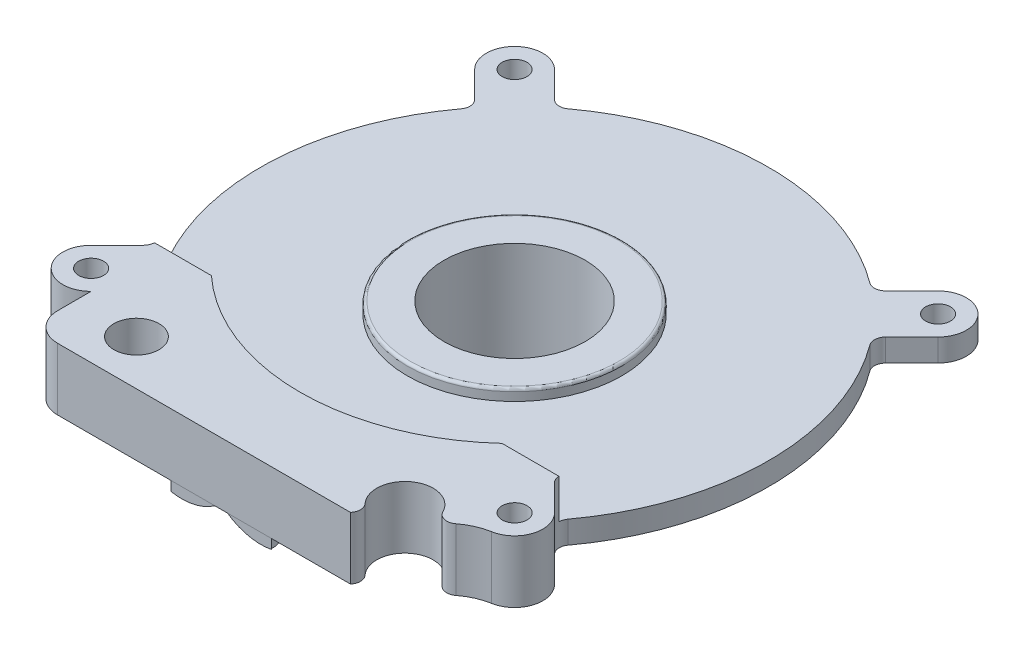
from build123d import *
from build123d.topology import SkipClean

# Parameters (mm, degrees)
SKETCH_1_R          = 15
SKETCH_1_R_2        = 12.5
EXTRUDE_1_DEPTH     = 20
SKETCH_2_R          = 17
SKETCH_2_R_2        = 12.5
EXTRUDE_2_DEPTH     = 6
SKETCH_3_R          = 12.5
SKETCH_3_R_2        = 7
SKETCH_3_R_3        = 1.65
EXTRUDE_3_DEPTH     = 3
EXTRUDE_START       = -2
SKETCH_5_R          = 19
SKETCH_5_R_2        = 17
EXTRUDE_5_DEPTH     = 2
SKETCH_6_W          = 26
SKETCH_6_H          = 26
SKETCH_6_R          = 12.5
EXTRUDE_6_DEPTH     = 2
EXTRUDE_START_2     = 4
SKETCH_7_R          = 45
SKETCH_7_R_2        = 17
EXTRUDE_7_DEPTH     = 4
EXTRUDE_START_3     = -4
SKETCH_8_R          = 2.2
EXTRUDE_8_DEPTH     = 4
SKETCH_9_R          = 4
EXTRUDE_9_DEPTH     = 4
FILLET_1_R          = 2
SKETCH_10_R         = 19
CUT_EXTRUDE_1_DEPTH = 74.492092218
FILLET_2_R          = 0.5
FILLET_3_R          = 5
SKETCH_11_R         = 3
CUT_EXTRUDE_2_DEPTH = 1.5
EXTRUDE_START_4     = 1
SKETCH_12_R         = 15.75
SKETCH_12_R_2       = 15
EXTRUDE_10_DEPTH    = 1
SKETCH_13_R         = 4
SKETCH_13_R_2       = 2.2
EXTRUDE_11_DEPTH    = 4.2
EXTRUDE_12_DEPTH    = 7
EXTRUDE_12_2_DEPTH  = 7
CHAMFER_1_SIZE      = 6.214619975
CHAMFER_1_SIZE_2    = 1.9
CHAMFER_2_SIZE      = 6.214619975
CHAMFER_2_SIZE_2    = 1.9
CUT_EXTRUDE_4_DEPTH = 10
FILLET_4_R          = 2
SKETCH_16_R         = 2.2
SKETCH_16_R_2       = 4
EXTRUDE_13_DEPTH    = 3
CUT_EXTRUDE_START   = -0.2
CUT_EXTRUDE_5_DEPTH = 0.2


with BuildPart() as part:
    # 草图1 → 凸台-拉伸1 (new body)
    with BuildSketch(Plane(origin=(0, 0, 0), x_dir=(1, 0, 0), z_dir=(0, 1, 0))):
        with Locations(Location((0, 0, 0), (0, 0, 270))):
            Circle(SKETCH_1_R)
        with Locations(Location((0, 0, 0), (0, 0, 270))):
            Circle(SKETCH_1_R_2, mode=Mode.SUBTRACT)
    extrude(amount=EXTRUDE_1_DEPTH)

    # 草图2 → 凸台-拉伸2 (add)
    with BuildSketch(Plane(origin=(0, 20, 0), x_dir=(1, 0, 0), z_dir=(0, 1, 0))):
        with Locations(Location((0, 0, 0), (0, 0, 270))):
            Circle(SKETCH_2_R)
        with Locations(Location((0, 0, 0), (0, 0, 270))):
            Circle(SKETCH_2_R_2, mode=Mode.SUBTRACT)
    extrude(amount=EXTRUDE_2_DEPTH)

    # 草图3 → 凸台-拉伸3 (add)
    with BuildSketch(Plane.XZ):
        with Locations(Location((0, 0, 0), (0, 0, 270))):
            Circle(SKETCH_3_R)
        with Locations(Location((0, 0, 0), (0, 0, 270))):
            Circle(SKETCH_3_R_2, mode=Mode.SUBTRACT)
        with Locations(Location((9.5, 0, 0), (0, 0, 270))):
            Circle(SKETCH_3_R_3, mode=Mode.SUBTRACT)
        with Locations(Location((-4.75, -8.227241336, 0), (0, 0, 270))):
            Circle(SKETCH_3_R_3, mode=Mode.SUBTRACT)
        with Locations(Location((-4.75, 8.227241336, 0), (0, 0, 270))):
            Circle(SKETCH_3_R_3, mode=Mode.SUBTRACT)
    extrude(amount=-EXTRUDE_3_DEPTH)

    # 草图5 → 凸台-拉伸5 (add)
    with BuildSketch(Plane(origin=(0, 26, 0), x_dir=(1, 0, 0), z_dir=(0, 1, 0)).offset(EXTRUDE_START)):
        with Locations(Location((0, 0, 0), (0, 0, 270))):
            Circle(SKETCH_5_R)
        with Locations(Location((0, 0, 0), (0, 0, 270))):
            Circle(SKETCH_5_R_2, mode=Mode.SUBTRACT)
    extrude(amount=EXTRUDE_5_DEPTH)

    # 草图6 → 凸台-拉伸6 (add)
    with BuildSketch(Plane(origin=(0, 26, 0), x_dir=(1, 0, 0), z_dir=(0, 1, 0))):
        Rectangle(SKETCH_6_W, SKETCH_6_H)
        with Locations(Location((0, 0, 0), (0, 0, 90))):
            Circle(SKETCH_6_R, mode=Mode.SUBTRACT)
    extrude(amount=EXTRUDE_6_DEPTH)

    # 草图7 → 凸台-拉伸7 (add)
    with BuildSketch(Plane.XZ.offset(-24).offset(EXTRUDE_START_2)):
        with Locations(Location((0, 0, 0), (0, 0, 270))):
            Circle(SKETCH_7_R)
        Circle(SKETCH_7_R_2, mode=Mode.SUBTRACT)
    extrude(amount=-EXTRUDE_7_DEPTH)

    # 草图8 → 凸台-拉伸8 (add)
    # profile 1 of 4: a face of its own
    with BuildSketch(Plane(origin=(0, 24, 0), x_dir=(1, 0, 0), z_dir=(0, 1, 0)).offset(EXTRUDE_START_3)):
        with BuildLine():
            Line((-41.035533906, -33.964466094), (-35.158310508, -28.087242696))
            ThreePointArc((-35.158310508, -28.087242696), (-31.819805153, -31.819805153), (-28.087242696, -35.158310508))
            Line((-28.087242696, -35.158310508), (-33.964466094, -41.035533906))
            ThreePointArc((-33.964466094, -41.035533906), (-41.035533906, -41.035533906), (-41.035533906, -33.964466094))
        make_face()
        with Locations(Location((-37.5, -37.5, 0), (0, 0, 270))):
            Circle(SKETCH_8_R, mode=Mode.SUBTRACT)
    # profile 2 of 4: a face of its own
    with BuildSketch(Plane(origin=(0, 24, 0), x_dir=(1, 0, 0), z_dir=(0, 1, 0)).offset(EXTRUDE_START_3)):
        with BuildLine():
            Line((-41.035533906, 33.964466094), (-35.158310508, 28.087242696))
            ThreePointArc((-35.158310508, 28.087242696), (-31.819805153, 31.819805153), (-28.087242696, 35.158310508))
            Line((-28.087242696, 35.158310508), (-33.964466094, 41.035533906))
            ThreePointArc((-33.964466094, 41.035533906), (-41.035533906, 41.035533906), (-41.035533906, 33.964466094))
        make_face()
        with Locations(Location((-37.5, 37.5, 0), (0, 0, 270))):
            Circle(SKETCH_8_R, mode=Mode.SUBTRACT)
    # profile 3 of 4: a face of its own
    with BuildSketch(Plane(origin=(0, 24, 0), x_dir=(1, 0, 0), z_dir=(0, 1, 0)).offset(EXTRUDE_START_3)):
        with BuildLine():
            Line((28.087242696, 35.158310508), (33.964466094, 41.035533906))
            ThreePointArc((33.964466094, 41.035533906), (41.035533906, 41.035533906), (41.035533906, 33.964466094))
            Line((41.035533906, 33.964466094), (35.158310508, 28.087242696))
            ThreePointArc((35.158310508, 28.087242696), (31.819805153, 31.819805153), (28.087242696, 35.158310508))
        make_face()
        with Locations(Location((37.5, 37.5, 0), (0, 0, 270))):
            Circle(SKETCH_8_R, mode=Mode.SUBTRACT)
    # profile 4 of 4: a face of its own
    with BuildSketch(Plane(origin=(0, 24, 0), x_dir=(1, 0, 0), z_dir=(0, 1, 0)).offset(EXTRUDE_START_3)):
        with BuildLine():
            Line((35.158310508, -28.087242696), (41.035533906, -33.964466094))
            ThreePointArc((41.035533906, -33.964466094), (41.035533906, -41.035533906), (33.964466094, -41.035533906))
            Line((33.964466094, -41.035533906), (28.087242696, -35.158310508))
            ThreePointArc((28.087242696, -35.158310508), (31.819805153, -31.819805153), (35.158310508, -28.087242696))
        make_face()
        with Locations(Location((37.5, -37.5, 0), (0, 0, 270))):
            Circle(SKETCH_8_R, mode=Mode.SUBTRACT)
    extrude(amount=EXTRUDE_8_DEPTH)

    # 草图9 → 凸台-拉伸9 (add)
    with BuildSketch(Plane(origin=(0, 24, 0), x_dir=(1, 0, 0), z_dir=(0, 1, 0)).offset(EXTRUDE_START_3)):
        with BuildLine():
            Line((33.964466094, -41.035533906), (28.087242696, -35.158310508))
            ThreePointArc((28.087242696, -35.158310508), (0, -45), (-28.087242696, -35.158310508))
            Line((-28.087242696, -35.158310508), (-33.964466094, -41.035533906))
            Line((-33.964466094, -41.035533906), (-33.964466094, -51.96236733))
            Line((-33.964466094, -51.96236733), (22.906384924, -51.96236733))
            Line((22.906384924, -51.96236733), (27.649740331, -50.798447588))
            ThreePointArc((27.649740331, -50.798447588), (23.364635585, -42.046040599), (31.045885235, -48.043136112))
            ThreePointArc((31.045885235, -48.043136112), (34.020425636, -44.337927578), (38.36930714, -42.423850637))
            ThreePointArc((38.36930714, -42.423850637), (35.996987316, -42.268747516), (33.964466094, -41.035533906))
        make_face()
        with Locations(Location((-23.001616716, -43.96067534, 0), (0, 0, 270))):
            Circle(SKETCH_9_R, mode=Mode.SUBTRACT)
    extrude(amount=EXTRUDE_9_DEPTH)

    # 圆角1
    # the kernel refuses this fillet: 2 mm, written as the material it takes off along each edge
    with BuildSketch(Plane(origin=(31.045885235, 8.214854918, 48.043136112), x_dir=(-0.015052067443698006, 0, -0.9998867112156609), z_dir=(0, 1, 0))) as fillet_1_piece_1:
        with BuildLine():
            CenterArc((5.237242596, -1.799472632), FILLET_1_R, 115.876571243, 100.980737452)
            Line((3.636978972, -2.999121053), (3.6049737, -3.023114021))
            ThreePointArc((3.6049737, -3.023114021), (1.972291731, -1.313047371), (-0.017457357, -0.035989453))
            Line((-0.017457357, -0.035989453), (0.017457357, 0.035989453))
            ThreePointArc((0.017457357, 0.035989453), (2.182187383, -0.461322512), (4.34691741, 0.035989453))
            Line((4.34691741, 0.035989453), (4.364374767, 0))
        make_face()
    extrude(amount=27.570290164, mode=Mode.SUBTRACT)
    with BuildSketch(Plane(origin=(27.649740331, 7.426134815, 50.798447588), x_dir=(-0.9711892764491741, 0, 0.23830944024551268), z_dir=(0, 1, 0))) as fillet_1_piece_2:
        with BuildLine():
            CenterArc((6.067575487, -1.612238295), FILLET_1_R, 126.281523765, 82.66024712)
            Line((4.317351562, -2.580079301), (4.282347084, -2.599436121))
            ThreePointArc((4.282347084, -2.599436121), (2.486180213, -0.742013172), (-0.000465948, -0.039997286))
            Line((-0.000465948, -0.039997286), (0, 0.04))
            ThreePointArc((0, 0.04), (2.442034484, 0.04), (4.860398838, 0.032244766))
            Line((4.860398838, 0.032244766), (4.884068968, 0))
        make_face()
    extrude(amount=29.147730371, mode=Mode.SUBTRACT)

    # 草图10 → 切除-拉伸1 (cut, through all)
    with BuildSketch(Plane(origin=(0, 26, 0), x_dir=(1, 0, 0), z_dir=(0, 1, 0))):
        with Locations(Location((0, 0, 0), (0, 0, 270))):
            Circle(SKETCH_10_R)
    extrude(amount=CUT_EXTRUDE_1_DEPTH, mode=Mode.SUBTRACT)

    # 圆角2
    fillet_2_edges = [part.edges().sort_by_distance(p)[0] for p in [
        (0, 26, -19),
    ]]
    fillet(fillet_2_edges, radius=FILLET_2_R)

    # 圆角3
    fillet_3_edges = [part.edges().sort_by_distance(p)[0] for p in [
        (-33.964466094, 22, 51.96236733),
    ]]
    fillet(fillet_3_edges, radius=FILLET_3_R)

    # 草图11 → 切除-拉伸2 (cut)
    with BuildSketch(Plane.XZ):
        with Locations((-4.75, 8.227241336)):
            Circle(SKETCH_11_R)
        with Locations((9.5, 0)):
            Circle(SKETCH_11_R)
        with Locations((-4.75, -8.227241336)):
            Circle(SKETCH_11_R)
    extrude(amount=-CUT_EXTRUDE_2_DEPTH, mode=Mode.SUBTRACT)

    # 草图12 → 凸台-拉伸10 (add)
    with BuildSketch(Plane.XZ.offset(-20).offset(EXTRUDE_START_4)):
        with Locations(Location((0, 0, 0), (0, 0, 90))):
            Circle(SKETCH_12_R)
        with Locations(Location((0, 0, 0), (0, 0, 270))):
            Circle(SKETCH_12_R_2, mode=Mode.SUBTRACT)
    extrude(amount=-EXTRUDE_10_DEPTH)

    # 草图13 → 凸台-拉伸11 (add)
    # profile 1 of 2: a face of its own
    with BuildSketch(Plane(origin=(0, 24, 0), x_dir=(1, 0, 0), z_dir=(0, 1, 0))):
        with BuildLine():
            Line((-25.73142074, -27.96236733), (-35.257708566, -27.96236733))
            ThreePointArc((-35.257708566, -27.96236733), (-35.2080649, -28.024849081), (-35.158310508, -28.087242696))
            ThreePointArc((-35.158310508, -28.087242696), (0, -45), (35.158310508, -28.087242696))
            ThreePointArc((35.158310508, -28.087242696), (35.2080649, -28.024849081), (35.257708566, -27.96236733))
            Line((35.257708566, -27.96236733), (25.73142074, -27.96236733))
            ThreePointArc((25.73142074, -27.96236733), (0, -38), (-25.73142074, -27.96236733))
        make_face()
    # profile 2 of 2: a face of its own
    with BuildSketch(Plane(origin=(0, 24, 0), x_dir=(1, 0, 0), z_dir=(0, 1, 0))):
        with BuildLine():
            ThreePointArc((35.158310508, -28.087242696), (0, -45), (-35.158310508, -28.087242696))
            Line((-35.158310508, -28.087242696), (-41.035533906, -33.964466094))
            ThreePointArc((-41.035533906, -33.964466094), (-41.035533906, -41.035533906), (-33.964466094, -41.035533906))
            Line((-33.964466094, -41.035533906), (-33.964466094, -46.96236733))
            ThreePointArc((-33.964466094, -46.96236733), (-32.5, -50.497901236), (-28.964466094, -51.96236733))
            Line((-28.964466094, -51.96236733), (22.906384924, -51.96236733))
            ThreePointArc((22.906384924, -51.96236733), (23.372168796, -50.629809961), (22.841917537, -49.321567873))
            ThreePointArc((22.841917537, -49.321567873), (23.665985567, -41.819836541), (30.980192372, -43.67925578))
            ThreePointArc((30.980192372, -43.67925578), (32.324226236, -44.729926812), (33.989922469, -44.361426197))
            ThreePointArc((33.989922469, -44.361426197), (36.06191813, -43.126615751), (38.36930714, -42.423850637))
            ThreePointArc((38.36930714, -42.423850637), (42.268747516, -39.003012684), (41.035533906, -33.964466094))
            Line((41.035533906, -33.964466094), (35.158310508, -28.087242696))
        make_face()
        with Locations(Location((-23.001616716, -43.96067534, 0), (0, 0, 270))):
            Circle(SKETCH_13_R, mode=Mode.SUBTRACT)
        with Locations(Location((-37.5, -37.5, 0), (0, 0, 270))):
            Circle(SKETCH_13_R_2, mode=Mode.SUBTRACT)
        with Locations(Location((37.5, -37.5, 0), (0, 0, 270))):
            Circle(SKETCH_13_R_2, mode=Mode.SUBTRACT)
    extrude(amount=EXTRUDE_11_DEPTH)

    # 圆角4
    # the kernel refuses this fillet: 2 mm, written as the material it adds along each edge
    with BuildSketch(Plane(origin=(-35.158310508, 24, 28.087242696), x_dir=(-0.6091445543009105, 0, -0.793059210882482), z_dir=(0, 1, 0))) as fillet_4_piece_1_section:
        with BuildLine():
            CenterArc((1.754855317, 1.99963613), FILLET_4_R, 187.472325658, 81.434718893)
            Line((-0.228160265, 1.739541528), (0, 0))
            ThreePointArc((0, 0), (0.858353144, 0.008187079), (1.716706288, 0))
        make_face()
    fillet_4_piece_1 = extrude(amount=4.2, mode=Mode.PRIVATE)
    fillet_4_piece_1 = split(fillet_4_piece_1, bisect_by=Plane(origin=(-35.158310508, 24, 27.96236733), z_dir=(0, 0, 1)), keep=Keep.TOP, mode=Mode.PRIVATE)
    add(fillet_4_piece_1)
    with BuildSketch(Plane(origin=(28.087242696, 20, -35.158310508), x_dir=(0.7071067811865485, 0, -0.7071067811865465), z_dir=(0, 1, 0)), Plane(origin=(-35.158310508, 20, -28.087242696), x_dir=(-0.7071067811865496, 0, -0.7071067811865455), z_dir=(0, 1, 0))) as fillet_4_piece_2:
        with BuildLine():
            CenterArc((1.754440604, 2), FILLET_4_R, 188.565281108, 81.434718892)
            ThreePointArc((-0.223253019, 1.70212766), (-0.103508957, 0.852128537), (0, 0))
            Line((0, 0), (1.754440604, 0))
        make_face()
    extrude(amount=4)
    with BuildSketch(Plane(origin=(35.158310508, 20, -28.087242696), x_dir=(0.6091445542993271, 0, 0.7930592108836982), z_dir=(0, 1, 0)), Plane(origin=(-28.087242696, 20, -35.158310508), x_dir=(0.7930592108837022, 0, -0.6091445542993219), z_dir=(0, 1, 0)), Plane(origin=(-35.158310508, 20, 28.087242696), x_dir=(-0.6091445542993226, 0, -0.7930592108837018), z_dir=(0, 1, 0))) as fillet_4_piece_3:
        with BuildLine():
            CenterArc((1.754855317, 1.99963613), FILLET_4_R, 187.472325658, 81.434718892)
            Line((-0.228160265, 1.739541528), (0, 0))
            ThreePointArc((0, 0), (0.858353144, 0.008187079), (1.716706288, 0))
        make_face()
    extrude(amount=4)
    with BuildSketch(Plane(origin=(35.158310508, 24, 28.087242696), x_dir=(0.6091445574940213, 0, -0.7930592084298707), z_dir=(0, 1, 0))) as fillet_4_piece_4_section:
        with BuildLine():
            CenterArc((1.754855324, -1.99963613), FILLET_4_R, 91.092955673, 81.4347189)
            Line((-0.228160259, -1.739541536), (0, 0))
            ThreePointArc((0, 0), (0.858353144, -0.008187083), (1.716706288, 0))
        make_face()
    fillet_4_piece_4 = extrude(amount=4.2, mode=Mode.PRIVATE)
    fillet_4_piece_4 = split(fillet_4_piece_4, bisect_by=Plane(origin=(35.158310508, 24, 27.96236733), z_dir=(0, 0, 1)), keep=Keep.TOP, mode=Mode.PRIVATE)
    add(fillet_4_piece_4)
    with BuildSketch(Plane(origin=(35.158310508, 20, 28.087242696), x_dir=(0.609144554299323, 0, -0.7930592108837013), z_dir=(0, 1, 0))) as fillet_4_piece_5:
        with BuildLine():
            CenterArc((1.754855317, -1.99963613), FILLET_4_R, 91.09295545, 81.434718892)
            Line((-0.228160265, -1.739541528), (0, 0))
            ThreePointArc((0, 0), (0.858353144, -0.008187079), (1.716706288, 0))
        make_face()
    extrude(amount=4)

    # 草图16 → 凸台-拉伸13 (add)
    with BuildSketch(Plane(origin=(0, 28.2, 0), x_dir=(1, 0, 0), z_dir=(0, 1, 0))):
        with BuildLine():
            Line((-25.73142074, -27.96236733), (-35.813695424, -27.96236733))
            ThreePointArc((-35.813695424, -27.96236733), (-35.974809945, -28.701442447), (-36.398887356, -29.327819544))
            Line((-36.398887356, -29.327819544), (-41.035533906, -33.964466094))
            ThreePointArc((-41.035533906, -33.964466094), (-41.035533906, -41.035533906), (-33.964466094, -41.035533906))
            Line((-33.964466094, -41.035533906), (-33.964466094, -46.96236733))
            ThreePointArc((-33.964466094, -46.96236733), (-32.5, -50.497901236), (-28.964466094, -51.96236733))
            Line((-28.964466094, -51.96236733), (22.906384924, -51.96236733))
            ThreePointArc((22.906384924, -51.96236733), (23.372168796, -50.629809961), (22.841917537, -49.321567873))
            ThreePointArc((22.841917537, -49.321567873), (23.665985567, -41.819836541), (30.980192372, -43.67925578))
            ThreePointArc((30.980192372, -43.67925578), (32.324226236, -44.729926812), (33.989922469, -44.361426197))
            ThreePointArc((33.989922469, -44.361426197), (36.06191813, -43.126615751), (38.36930714, -42.423850637))
            ThreePointArc((38.36930714, -42.423850637), (42.268747516, -39.003012684), (41.035533906, -33.964466094))
            Line((41.035533906, -33.964466094), (36.398887356, -29.327819544))
            ThreePointArc((36.398887356, -29.327819544), (35.974809945, -28.701442447), (35.813695424, -27.96236733))
            Line((35.813695424, -27.96236733), (25.73142074, -27.96236733))
            ThreePointArc((25.73142074, -27.96236733), (0, -38), (-25.73142074, -27.96236733))
        make_face()
        with Locations(Location((-37.5, -37.5, 0), (0, 0, 270))):
            Circle(SKETCH_16_R, mode=Mode.SUBTRACT)
        with Locations(Location((-23.001616716, -43.96067534, 0), (0, 0, 270))):
            Circle(SKETCH_16_R_2, mode=Mode.SUBTRACT)
        with Locations(Location((37.5, -37.5, 0), (0, 0, 270))):
            Circle(SKETCH_16_R, mode=Mode.SUBTRACT)
    extrude(amount=EXTRUDE_13_DEPTH)

    # 草图17 → 切除-拉伸5 (cut)
    with SkipClean():  # the faces are left unmerged after this step: merging them gives an invalid solid
        with BuildSketch(Plane(origin=(0, 31.2, 0), x_dir=(1, 0, 0), z_dir=(0, 1, 0)).offset(CUT_EXTRUDE_START)):
            with BuildLine():
                Line((-25.73142074, -27.96236733), (-35.813695424, -27.96236733))
                ThreePointArc((-35.813695424, -27.96236733), (-35.974809945, -28.701442447), (-36.398887356, -29.327819544))
                Line((-36.398887356, -29.327819544), (-41.035533906, -33.964466094))
                ThreePointArc((-41.035533906, -33.964466094), (-41.035533906, -41.035533906), (-33.964466094, -41.035533906))
                Line((-33.964466094, -41.035533906), (-33.964466094, -46.96236733))
                ThreePointArc((-33.964466094, -46.96236733), (-32.5, -50.497901236), (-28.964466094, -51.96236733))
                Line((-28.964466094, -51.96236733), (22.906384924, -51.96236733))
                ThreePointArc((22.906384924, -51.96236733), (23.372168796, -50.629809961), (22.841917537, -49.321567873))
                ThreePointArc((22.841917537, -49.321567873), (23.665985567, -41.819836541), (30.980192372, -43.67925578))
                ThreePointArc((30.980192372, -43.67925578), (32.324226236, -44.729926812), (33.989922469, -44.361426197))
                ThreePointArc((33.989922469, -44.361426197), (36.06191813, -43.126615751), (38.36930714, -42.423850637))
                ThreePointArc((38.36930714, -42.423850637), (42.268747516, -39.003012684), (41.035533906, -33.964466094))
                Line((41.035533906, -33.964466094), (36.398887356, -29.327819544))
                ThreePointArc((36.398887356, -29.327819544), (35.974809945, -28.701442447), (35.813695424, -27.96236733))
                Line((35.813695424, -27.96236733), (25.73142074, -27.96236733))
                ThreePointArc((25.73142074, -27.96236733), (0, -38), (-25.73142074, -27.96236733))
            make_face()
        extrude(amount=CUT_EXTRUDE_5_DEPTH, mode=Mode.SUBTRACT)


with BuildPart() as body_2:
    # 草图14 → 凸台-拉伸12 (new body)
    with BuildSketch(Plane.XY.offset(51.96236733)):
        with BuildLine():
            Line((-8.9, 20), (-8.9, 18.309193402))
            ThreePointArc((-8.9, 18.309193402), (-4.839364384, 18.362300557), (-1.123247794, 20))
            Line((-1.123247794, 20), (-8.9, 20))
        make_face()
    extrude(amount=-EXTRUDE_12_DEPTH)

    # 倒角2
    # the kernel refuses this chamfer: 6.214619975, 1.9 mm, written as the material it takes off along each edge
    with BuildSketch(Plane(origin=(-7, 28.3, 44.96236733), x_dir=(-0.9793563195214127, 0.20214153312338567, 0), z_dir=(0.20214153312338567, 0.9793563195214127, 0))) as chamfer_2_piece_1:
        Polygon((10.169868066, CHAMFER_2_SIZE), (10.169868066 - CHAMFER_2_SIZE_2, 0), (10.169868066, 0), align=None)
    revolve(axis=Axis((-7, 28.3, 44.96236733), (0, 0, 1)), revolution_arc=227.856914302, mode=Mode.SUBTRACT)


with BuildPart() as body_3:
    # 草图14 → Extrude 12 2 (new body)
    with BuildSketch(Plane.XY.offset(51.96236733)):
        with BuildLine():
            Line((8.9, 18.309193402), (8.9, 20))
            Line((8.9, 20), (1.123247794, 20))
            ThreePointArc((1.123247794, 20), (4.839364384, 18.362300557), (8.9, 18.309193402))
        make_face()
    extrude(amount=-EXTRUDE_12_2_DEPTH)

    # 倒角1
    # the kernel refuses this chamfer: 6.214619975, 1.9 mm, written as the material it takes off along each edge
    with BuildSketch(Plane(origin=(7, 28.3, 44.96236733), x_dir=(-0.8070149800028303, 0.5905309662084042, 0), z_dir=(0.5905309662084042, 0.8070149800028303, 0))) as chamfer_1_piece_1:
        Polygon((10.169868066, CHAMFER_1_SIZE), (10.169868066 - CHAMFER_1_SIZE_2, 0), (10.169868066, 0), align=None)
    revolve(axis=Axis((7, 28.3, 44.96236733), (0, 0, 1)), revolution_arc=227.856914302, mode=Mode.SUBTRACT)

    # 草图15 → 切除-拉伸4 (cut)
    with BuildSketch(Plane.XZ.offset(-20)):
        with BuildLine():
            Line((12.726349477, 51.96236733), (8.749992214, 51.961517474))
            ThreePointArc((8.749992214, 51.961517474), (8.140258783, 45.114432982), (6.330246869, 38.482827009))
            Line((6.330246869, 38.482827009), (12.726349477, 51.96236733))
        make_face()
    extrude(amount=CUT_EXTRUDE_4_DEPTH, mode=Mode.SUBTRACT)


solid = Compound([part.part, body_2.part, body_3.part])
